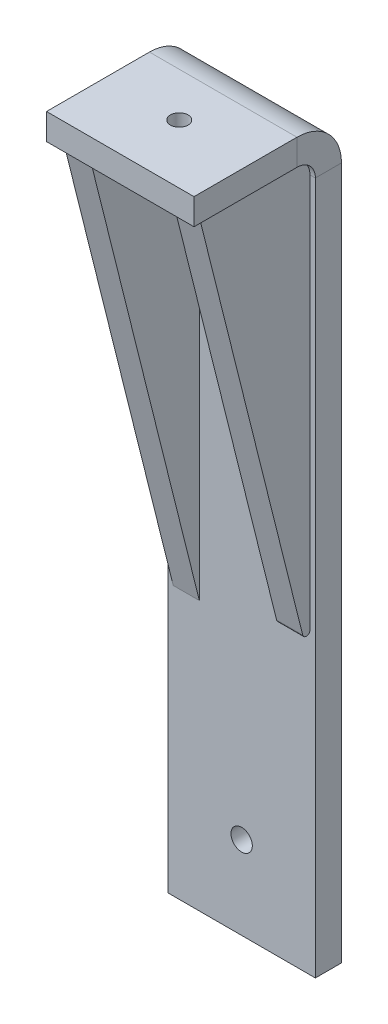
from build123d import *

# Parameters (mm, degrees)
SKETCH2_W                    = 25.4
SKETCH2_H                    = 4.4958
BASE_FLANGE1_DEPTH           = 127
EDGE_FLANGE1_STRIP_W         = 24.3332
EDGE_FLANGE1_STRIP_H         = 4.4958
EDGE_FLANGE1_STRIP_CUT_DEPTH = 25.4
EDGE_FLANGE1_DEPTH           = 25.4
CUT_EXTRUDE1_REACH           = 132.136
SKETCH10_R                   = 1.524
SKETCH11_R                   = 1.8415
CUT_EXTRUDE2_DEPTH           = 130.333969156
BOSS_EXTRUDE1_START          = 9.525
BOSS_EXTRUDE1_DEPTH          = 2.2479
FILLET1_R                    = 0.635


# Sheet-metal steps are written as plain solids
with BuildPart() as part:
    # Sketch2 → Base-Flange1 (new body)
    with BuildSketch(Plane(origin=(0, 0, 0), x_dir=(1, 0, 0), z_dir=(0, 1, 0))):
        with Locations((0, -2.2479)):
            Rectangle(SKETCH2_W, SKETCH2_H)
    extrude(amount=BASE_FLANGE1_DEPTH)

    # Edge-Flange1 strip (across the edge) → Edge-Flange1 strip cut (cut)
    with BuildSketch(Plane(origin=(12.7, 127, 4.4958), x_dir=(0, -1, 0), z_dir=(-1, 0, 0))):
        with Locations((-4.4958, -2.2479)):
            Rectangle(EDGE_FLANGE1_STRIP_W, EDGE_FLANGE1_STRIP_H)
    extrude(amount=EDGE_FLANGE1_STRIP_CUT_DEPTH, mode=Mode.SUBTRACT)

    # Edge-Flange1 section (across the edge) → Edge-Flange1 (add)
    with BuildSketch(Plane(origin=(12.7, 127, 4.4958), x_dir=(0, -1, 0), z_dir=(-1, 0, 0))):
        with BuildLine():
            Line((0, 3.175), (0, 20.9042))
            Line((0, 20.9042), (4.4958, 20.9042))
            Line((4.4958, 20.9042), (4.4958, 3.175))
            ThreePointArc((4.4958, 3.175), (5.42573597, 0.92993597), (7.6708, 0))
            Line((7.6708, 0), (7.6708, -4.4958))
            ThreePointArc((7.6708, -4.4958), (2.246725303, -2.249074697), (0, 3.175))
        make_face()
    extrude(amount=EDGE_FLANGE1_DEPTH)

    # Sketch10 → Cut-Extrude1 (cut, up to next)
    with BuildSketch(Plane(origin=(0, 127, 0), x_dir=(1, 0, 0), z_dir=(0, 1, 0)), mode=Mode.PRIVATE) as cut_extrude1_sk1:
        with Locations(Location((0, -15.24, 0), (0, 0, 270))):
            Circle(SKETCH10_R)
    cut_extrude1_tool1 = extrude(cut_extrude1_sk1.sketch, amount=-CUT_EXTRUDE1_REACH, mode=Mode.PRIVATE) & part.part
    add(cut_extrude1_tool1.solids().sort_by_distance((0, 127, 15.24))[0], mode=Mode.SUBTRACT)

    # Sketch11 → Cut-Extrude2 (cut, through all)
    with BuildSketch(Plane.XY.offset(4.4958)):
        with Locations((0, 14.280866767)):
            Circle(SKETCH11_R)
    extrude(amount=-CUT_EXTRUDE2_DEPTH, mode=Mode.SUBTRACT)


with BuildPart() as body_2:
    # Sketch12 → Boss-Extrude1 (new, symmetric)
    with BuildSketch(Plane(origin=(0, 0, 0), x_dir=(0, 0, -1), z_dir=(1, 0, 0)).offset(BOSS_EXTRUDE1_START)):
        with BuildLine():
            Line((-23.5458, 122.5042), (-4.4958, 46.3042))
            Line((-4.4958, 46.3042), (-4.4958, 119.3292))
            ThreePointArc((-4.4958, 119.3292), (-5.42573597, 121.57426403), (-7.6708, 122.5042))
            Line((-7.6708, 122.5042), (-23.5458, 122.5042))
        make_face()
    extrude(amount=BOSS_EXTRUDE1_DEPTH, both=True)


with BuildPart() as body_3:
    # Mirror2: mirrored copy
    add(body_2.part.mirror(Plane(origin=(0, 0, 0), x_dir=(0, 0, 1), z_dir=(1, 0, 0))))


with BuildPart() as body_2_1:
    add(body_2.part)

    # Fillet1
    fillet1_edges = [body_2_1.edges().sort_by_distance(p)[0] for p in [
        (9.525, 46.3042, 4.4958),
        (9.525, 122.5042, 23.5458),
    ]]
    fillet(fillet1_edges, radius=FILLET1_R)


solid = Compound([part.part, body_3.part, body_2_1.part])
